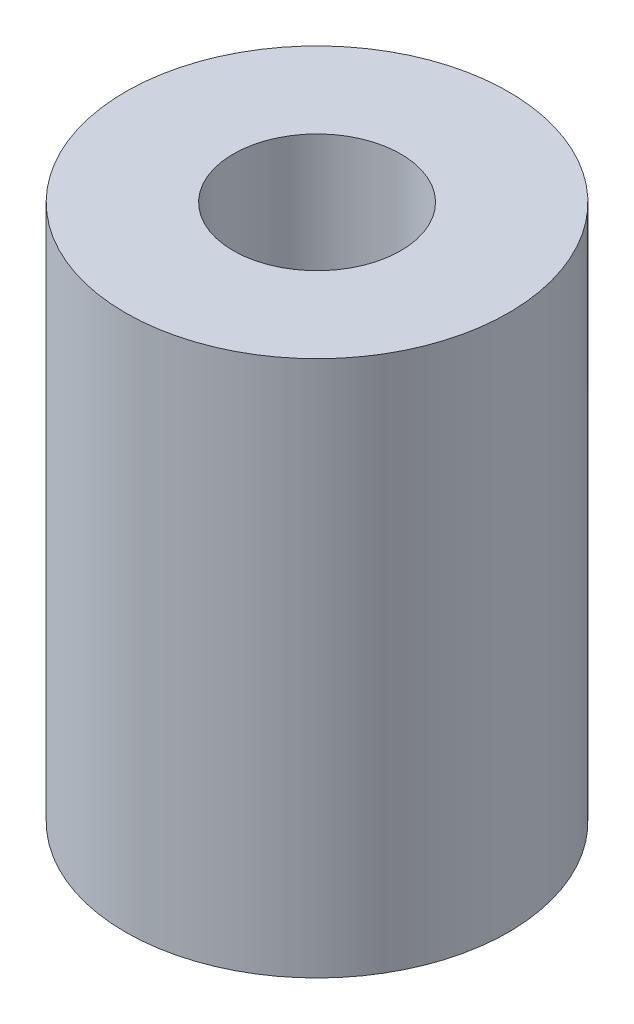
from build123d import *

# Parameters (mm, degrees)
SKETCH_1_R      = 4
SKETCH_1_R_2    = 1.75
EXTRUDE_1_DEPTH = 11.2


with BuildPart() as part:
    # 草图1 → 凸台-拉伸1 (new body)
    with BuildSketch(Plane(origin=(0, 0, 0), x_dir=(1, 0, 0), z_dir=(0, 1, 0))):
        Circle(SKETCH_1_R)
        Circle(SKETCH_1_R_2, mode=Mode.SUBTRACT)
    extrude(amount=EXTRUDE_1_DEPTH)


solid = part.part
